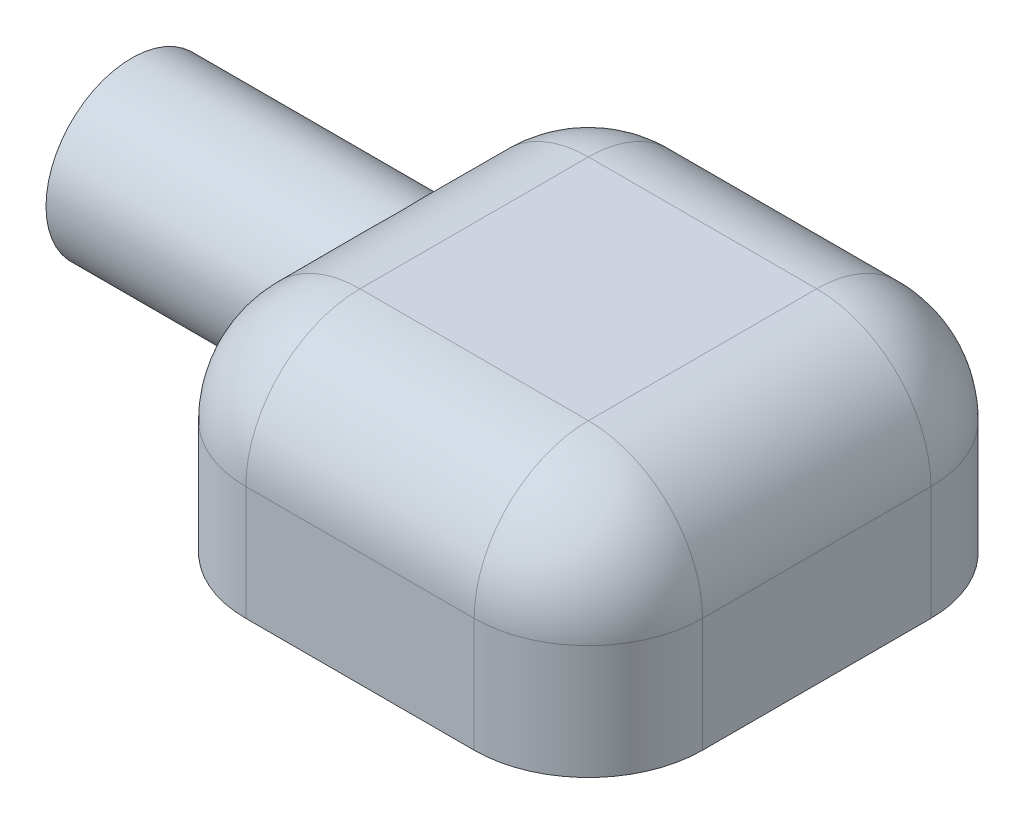
from build123d import *

# Parameters (mm, degrees)
SKETCH1_W           = 40
SKETCH1_H           = 40
BOSS_EXTRUDE1_DEPTH = 20
SKETCH2_R           = 5
CUT_EXTRUDE1_DEPTH  = 10
SKETCH3_R           = 7.5
BOSS_EXTRUDE2_DEPTH = 20
FILLET1_R           = 10


with BuildPart() as part:
    # Sketch1 → Boss-Extrude1 (new body)
    with BuildSketch(Plane(origin=(0, 0, 0), x_dir=(1, 0, 0), z_dir=(0, 1, 0))):
        Rectangle(SKETCH1_W, SKETCH1_H)
    extrude(amount=BOSS_EXTRUDE1_DEPTH)

    # Sketch2 → Cut-Extrude1 (cut)
    with BuildSketch(Plane.XZ):
        with Locations(Location((0, 0, 0), (0, 0, 270))):
            Circle(SKETCH2_R)
    extrude(amount=-CUT_EXTRUDE1_DEPTH, mode=Mode.SUBTRACT)

    # Sketch3 → Boss-Extrude2 (add)
    with BuildSketch(Plane.ZY.offset(20)):
        with Locations((0, 10)):
            Circle(SKETCH3_R)
    extrude(amount=BOSS_EXTRUDE2_DEPTH)

    # Fillet1
    # the kernel refuses this fillet: 10 mm, written as the material it takes off along each edge
    with BuildSketch(Plane(origin=(10, 10, -10), x_dir=(0, 1, 0), z_dir=(1, 0, 0))) as fillet1_piece_1_section:
        Polygon((0, 0), (FILLET1_R, 0), (FILLET1_R, -FILLET1_R), (0, -FILLET1_R), align=None)
    fillet1_piece_1 = extrude(amount=FILLET1_R, mode=Mode.PRIVATE)
    fillet1_piece_1 = fillet1_piece_1 - Plane(origin=(10, 10, -10), x_dir=(0, -0.7071067811865475, 0.7071067811865475), z_dir=(1, 0, 0)) * Sphere(FILLET1_R, mode=Mode.PRIVATE)
    add(fillet1_piece_1, mode=Mode.SUBTRACT)
    with BuildSketch(Plane(origin=(10, 10, 10), x_dir=(1, 0, 0), z_dir=(0, 0, 1))) as fillet1_piece_2_section:
        Polygon((0, 0), (FILLET1_R, 0), (FILLET1_R, FILLET1_R), (0, FILLET1_R), align=None)
    fillet1_piece_2 = extrude(amount=FILLET1_R, mode=Mode.PRIVATE)
    fillet1_piece_2 = fillet1_piece_2 - Plane(origin=(10, 10, 10), x_dir=(-0.7071067811865475, -0.7071067811865475, 0), z_dir=(0, 0, 1)) * Sphere(FILLET1_R, mode=Mode.PRIVATE)
    add(fillet1_piece_2, mode=Mode.SUBTRACT)
    with BuildSketch(Plane(origin=(-10, 10, -10), x_dir=(0, 1, 0), z_dir=(-1, 0, 0))) as fillet1_piece_3_section:
        Polygon((0, 0), (FILLET1_R, 0), (FILLET1_R, FILLET1_R), (0, FILLET1_R), align=None)
    fillet1_piece_3 = extrude(amount=FILLET1_R, mode=Mode.PRIVATE)
    fillet1_piece_3 = fillet1_piece_3 - Plane(origin=(-10, 10, -10), x_dir=(0, -0.7071067811865475, 0.7071067811865475), z_dir=(-1, 0, 0)) * Sphere(FILLET1_R, mode=Mode.PRIVATE)
    add(fillet1_piece_3, mode=Mode.SUBTRACT)
    with BuildSketch(Plane(origin=(-10, 10, 10), x_dir=(-1, 0, 0), z_dir=(0, 0, 1))) as fillet1_piece_4_section:
        Polygon((0, 0), (FILLET1_R, 0), (FILLET1_R, -FILLET1_R), (0, -FILLET1_R), align=None)
    fillet1_piece_4 = extrude(amount=FILLET1_R, mode=Mode.PRIVATE)
    fillet1_piece_4 = fillet1_piece_4 - Plane(origin=(-10, 10, 10), x_dir=(0.7071067811865475, -0.7071067811865475, 0), z_dir=(0, 0, 1)) * Sphere(FILLET1_R, mode=Mode.PRIVATE)
    add(fillet1_piece_4, mode=Mode.SUBTRACT)
    with BuildSketch(Plane(origin=(20, 20, -10), x_dir=(0, -1, 0), z_dir=(0, 0, 1)), Plane(origin=(10, 20, 20), x_dir=(0, -1, 0), z_dir=(-1, 0, 0))) as fillet1_piece_5:
        with BuildLine():
            CenterArc((FILLET1_R, -FILLET1_R), FILLET1_R, 90, 90)
            Line((0, -FILLET1_R), (0, 0))
            Line((0, 0), (FILLET1_R, 0))
        make_face()
    extrude(amount=20, mode=Mode.SUBTRACT)
    with BuildSketch(Plane(origin=(-10, 20, -20), x_dir=(0, 0, 1), z_dir=(1, 0, 0))) as fillet1_piece_6:
        with BuildLine():
            CenterArc((FILLET1_R, FILLET1_R), FILLET1_R, 180, 90)
            Line((0, FILLET1_R), (0, 0))
            Line((0, 0), (FILLET1_R, 0))
        make_face()
    extrude(amount=20, mode=Mode.SUBTRACT)
    with BuildSketch(Plane(origin=(-20, 20, 10), x_dir=(0, -1, 0), z_dir=(0, 0, -1))) as fillet1_piece_7_section:
        with BuildLine():
            CenterArc((FILLET1_R, -FILLET1_R), FILLET1_R, 90, 90)
            Line((0, -FILLET1_R), (0, 0))
            Line((0, 0), (FILLET1_R, 0))
        make_face()
    fillet1_piece_7 = extrude(amount=20, mode=Mode.PRIVATE)
    fillet1_piece_7 = fillet1_piece_7 - Plane(origin=(-17.405135358, 10, 0), x_dir=(0, 0, 1), z_dir=(1, 0, 0)) * Cylinder(7.5, 80, mode=Mode.PRIVATE)
    add(fillet1_piece_7, mode=Mode.SUBTRACT)
    with BuildSketch(Plane(origin=(-20, -25, -20), x_dir=(0, 0, 1), z_dir=(0, 1, 0)), Plane(origin=(-20, -25, 20), x_dir=(1, 0, 0), z_dir=(0, 1, 0))) as fillet1_piece_8:
        with BuildLine():
            CenterArc((FILLET1_R, FILLET1_R), FILLET1_R, 180, 90)
            Line((0, FILLET1_R), (0, 0))
            Line((0, 0), (FILLET1_R, 0))
        make_face()
    extrude(amount=35, mode=Mode.SUBTRACT)
    with BuildSketch(Plane(origin=(20, -25, -20), x_dir=(0, 0, 1), z_dir=(0, 1, 0)), Plane(origin=(20, -25, 20), x_dir=(-1, 0, 0), z_dir=(0, 1, 0))) as fillet1_piece_9:
        with BuildLine():
            CenterArc((FILLET1_R, -FILLET1_R), FILLET1_R, 90, 90)
            Line((0, -FILLET1_R), (0, 0))
            Line((0, 0), (FILLET1_R, 0))
        make_face()
    extrude(amount=35, mode=Mode.SUBTRACT)


solid = part.part
